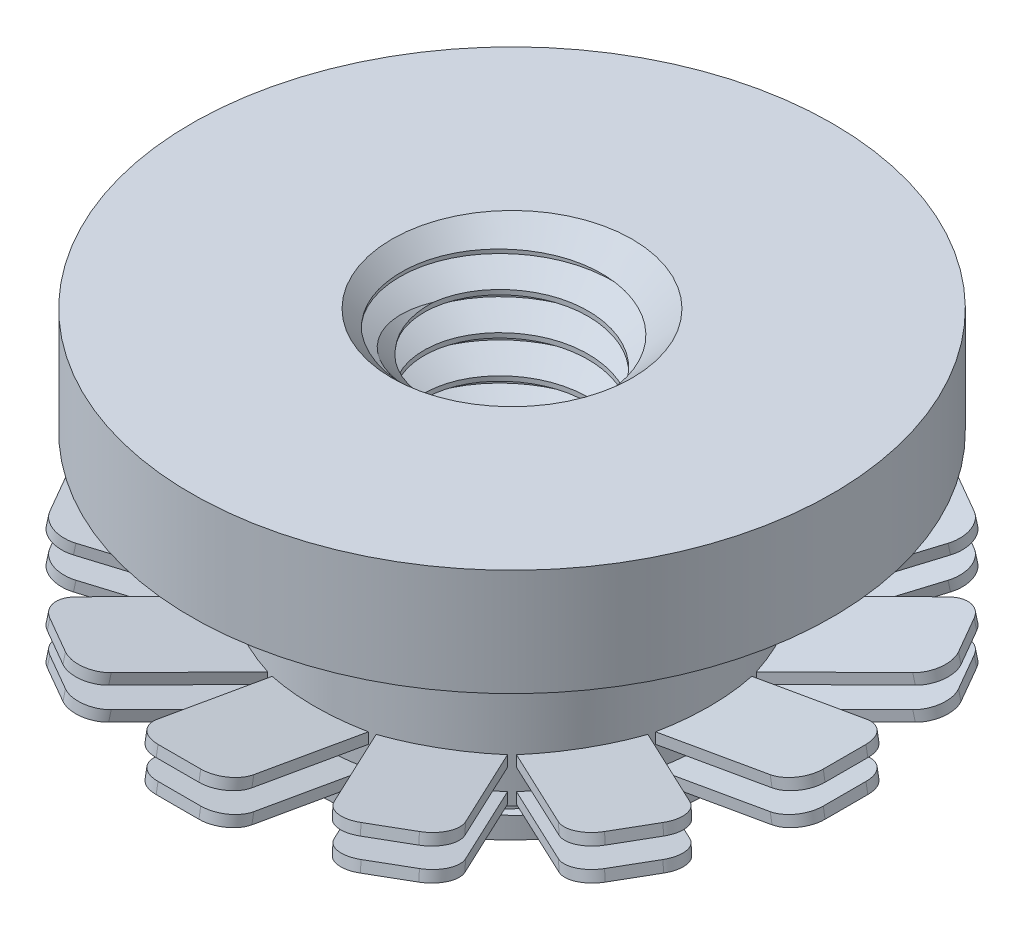
from build123d import *

# Parameters (mm, degrees)
CROWN_TOOTH_DEPTH            = 0.9
CROWN_TOOTH_DEPTH_BACK       = 0.9
FILLET1_R                    = 0.5
TOOTH_PATTERN_COUNT          = 12
LPATTERN3_COUNT              = 2
LPATTERN3_PITCH              = 0.6
SWEEP1_PITCH                 = 0.7
SKETCH10_R                   = 2.25
CUT_EXTRUDE1_OTHER_WAY_DEPTH = 11.695219757
CUT_EXTRUDE1_OTHER_WAY_TAPER = -45


with BuildPart() as part:
    # Sketch2 → Body (revolve)
    with BuildSketch(Plane.XY, mode=Mode.PRIVATE) as body_sk:
        Polygon((-2, 6), (-6, 6), (-6, 4), (-5.2, 4), (-5.2, 3.5), (-3.7, 3.5), (-3.7, 0.55), (-3.55, 0.55), (-3.55, 0.4), (-3.7, 0.4), (-3.7, 0), (-2, 0), align=None)
    revolve(body_sk.sketch.rotate(Axis((0, 0, 0), (0, 1, 0)), 270), axis=Axis((0, 0, 0), (0, 1, 0)))

    # Sweep1: the profile of Sketch9 profile screwed along a right-hand helix of 7.857143 turns, 6 arcs to a turn; built about Z, then put on its axis
    sweep1_z = Axis((0, 0, 0), (0, 0, 1))
    sweep1_corners = [(2.0003, 0, -0.612673205), (2.0003, 0, 0.000173205), (1.545336663, 0, -0.2625), (1.545336663, 0, -0.35)]
    with BuildLine(mode=Mode.PRIVATE) as sweep1_profile:
        Line(sweep1_corners[0], sweep1_corners[1])
        Line(sweep1_corners[1], sweep1_corners[2])
        Line(sweep1_corners[2], sweep1_corners[3])
        Line(sweep1_corners[3], sweep1_corners[0])
    sweep1_cap = Face(sweep1_profile.wire())
    sweep1_turn_angles = [0, 30, 60, 90, 120, 150, 180, 210, 240, 270, 300, 330, 360]
    sweep1_turn_weights = [1, 0.8660254037844387, 1, 0.8660254037844387, 1, 0.8660254037844387, 1, 0.8660254037844387, 1, 0.8660254037844387, 1, 0.8660254037844387, 1]
    sweep1_turn_rails = [Edge.make_bspline([Vector(p[0], p[1], 0).rotate(sweep1_z, sweep1_turn_angles[k]) / sweep1_turn_weights[k] + Vector(0, 0, p[2] + SWEEP1_PITCH * sweep1_turn_angles[k] / 360) for k in range(13)], [0, 0, 0, 1, 1, 2, 2, 3, 3, 4, 4, 5, 5, 6, 6, 6], 2, sweep1_turn_weights) for p in sweep1_corners]
    sweep1_turn_sides = [Face.make_surface_from_curves(sweep1_turn_rails[p[0]], sweep1_turn_rails[p[1]]) for p in [(0, 1), (1, 2), (2, 3), (3, 0)]]
    sweep1_last_angles = [2520, 2550, 2580, 2610, 2640, 2670, 2700, 2730, 2760, 2790, 2820, 2824.285714286, 2828.571428571]
    sweep1_last_weights = [1, 0.8660254037844387, 1, 0.8660254037844387, 1, 0.8660254037844387, 1, 0.8660254037844387, 1, 0.8660254037844387, 1, 0.9972037971811696, 1]
    sweep1_last_rails = [Edge.make_bspline([Vector(p[0], p[1], 0).rotate(sweep1_z, sweep1_last_angles[k]) / sweep1_last_weights[k] + Vector(0, 0, p[2] + SWEEP1_PITCH * sweep1_last_angles[k] / 360) for k in range(13)], [0, 0, 0, 1, 1, 2, 2, 3, 3, 4, 4, 5, 5, 6, 6, 6], 2, sweep1_last_weights) for p in sweep1_corners]
    sweep1_last_sides = [Face.make_surface_from_curves(sweep1_last_rails[p[0]], sweep1_last_rails[p[1]]) for p in [(0, 1), (1, 2), (2, 3), (3, 0)]]
    sweep1 = Plane(origin=(0, 6, 0), x_dir=(1, 0, 0), z_dir=(0, -1, 0)) * Solid(Shell([*[p.moved(Location((0, 0, SWEEP1_PITCH * i))) for i in range(7) for p in sweep1_turn_sides], *sweep1_last_sides, sweep1_cap, sweep1_cap.rotate(sweep1_z, 2828.571428571).moved(Location((0, 0, SWEEP1_PITCH * 2828.571428571 / 360)))]))
    add(sweep1)

    # Cut-Extrude1 cone 1 section (through the dimple's axis) → Cut-Extrude1 (revolve, cut)
    with BuildSketch(Plane(origin=(0, 6, 0), x_dir=(0, 0, 1), z_dir=(1, 0, 0))):
        Polygon((0, 0), (2.25, 0), (0, 2.25), align=None)
    revolve(axis=Axis((0, 6, 0), (0, -1, 0)), mode=Mode.SUBTRACT)

    # Sketch10 → Cut-Extrude1 other way (cut)
    with BuildSketch(Plane(origin=(0, 6, 0), x_dir=(1, 0, 0), z_dir=(0, 1, 0))):
        Circle(SKETCH10_R)
    extrude(amount=CUT_EXTRUDE1_OTHER_WAY_DEPTH, taper=CUT_EXTRUDE1_OTHER_WAY_TAPER, mode=Mode.SUBTRACT)


with BuildPart() as body_2:
    # Sketch5 → crown Tooth (new, two sides: drawn at the far end of the back side and taken through both)
    with BuildSketch(Plane.XY.offset(-CROWN_TOOTH_DEPTH_BACK)):
        Polygon((-6.260500158, 1.051485262), (-6.225770522, 1.248446813), (-3.465270364, 0.761696154), (-3.5, 0.564734604), align=None)
    extrude(amount=CROWN_TOOTH_DEPTH + CROWN_TOOTH_DEPTH_BACK)

    # Fillet1
    fillet1_edges = [body_2.edges().sort_by_distance(p)[0] for p in [
        (-6.24313534, 1.149966037, -0.9),
        (-6.24313534, 1.149966037, 0.9),
    ]]
    fillet(fillet1_edges, radius=FILLET1_R)


with BuildPart() as tooth_pattern_1:
    # Tooth Pattern: pattern copy
    add(body_2.part.rotate(Axis((0, 0, 0), (0, 1, 0)), 1 * 360 / TOOTH_PATTERN_COUNT))


with BuildPart() as tooth_pattern_2:
    # Tooth Pattern: pattern copy
    add(body_2.part.rotate(Axis((0, 0, 0), (0, 1, 0)), 2 * 360 / TOOTH_PATTERN_COUNT))


with BuildPart() as tooth_pattern_3:
    # Tooth Pattern: pattern copy
    add(body_2.part.rotate(Axis((0, 0, 0), (0, 1, 0)), 3 * 360 / TOOTH_PATTERN_COUNT))


with BuildPart() as tooth_pattern_4:
    # Tooth Pattern: pattern copy
    add(body_2.part.rotate(Axis((0, 0, 0), (0, 1, 0)), 4 * 360 / TOOTH_PATTERN_COUNT))


with BuildPart() as tooth_pattern_5:
    # Tooth Pattern: pattern copy
    add(body_2.part.rotate(Axis((0, 0, 0), (0, 1, 0)), 5 * 360 / TOOTH_PATTERN_COUNT))


with BuildPart() as tooth_pattern_6:
    # Tooth Pattern: pattern copy
    add(body_2.part.rotate(Axis((0, 0, 0), (0, 1, 0)), 6 * 360 / TOOTH_PATTERN_COUNT))


with BuildPart() as tooth_pattern_7:
    # Tooth Pattern: pattern copy
    add(body_2.part.rotate(Axis((0, 0, 0), (0, 1, 0)), 7 * 360 / TOOTH_PATTERN_COUNT))


with BuildPart() as tooth_pattern_8:
    # Tooth Pattern: pattern copy
    add(body_2.part.rotate(Axis((0, 0, 0), (0, 1, 0)), 8 * 360 / TOOTH_PATTERN_COUNT))


with BuildPart() as tooth_pattern_9:
    # Tooth Pattern: pattern copy
    add(body_2.part.rotate(Axis((0, 0, 0), (0, 1, 0)), 9 * 360 / TOOTH_PATTERN_COUNT))


with BuildPart() as tooth_pattern_10:
    # Tooth Pattern: pattern copy
    add(body_2.part.rotate(Axis((0, 0, 0), (0, 1, 0)), 10 * 360 / TOOTH_PATTERN_COUNT))


with BuildPart() as tooth_pattern_11:
    # Tooth Pattern: pattern copy
    add(body_2.part.rotate(Axis((0, 0, 0), (0, 1, 0)), 11 * 360 / TOOTH_PATTERN_COUNT))


with BuildPart() as lpattern3_1:
    # LPattern3: pattern copy
    add(tooth_pattern_1.part.moved(Location(Vector(0, 1, 0) * (1 * LPATTERN3_PITCH))))


with BuildPart() as lpattern3_2:
    # LPattern3: pattern copy
    add(body_2.part.moved(Location(Vector(0, 1, 0) * (1 * LPATTERN3_PITCH))))


with BuildPart() as lpattern3_3:
    # LPattern3: pattern copy
    add(tooth_pattern_3.part.moved(Location(Vector(0, 1, 0) * (1 * LPATTERN3_PITCH))))


with BuildPart() as lpattern3_4:
    # LPattern3: pattern copy
    add(tooth_pattern_2.part.moved(Location(Vector(0, 1, 0) * (1 * LPATTERN3_PITCH))))


with BuildPart() as lpattern3_5:
    # LPattern3: pattern copy
    add(tooth_pattern_11.part.moved(Location(Vector(0, 1, 0) * (1 * LPATTERN3_PITCH))))


with BuildPart() as lpattern3_6:
    # LPattern3: pattern copy
    add(tooth_pattern_10.part.moved(Location(Vector(0, 1, 0) * (1 * LPATTERN3_PITCH))))


with BuildPart() as lpattern3_7:
    # LPattern3: pattern copy
    add(tooth_pattern_9.part.moved(Location(Vector(0, 1, 0) * (1 * LPATTERN3_PITCH))))


with BuildPart() as lpattern3_8:
    # LPattern3: pattern copy
    add(tooth_pattern_8.part.moved(Location(Vector(0, 1, 0) * (1 * LPATTERN3_PITCH))))


with BuildPart() as lpattern3_9:
    # LPattern3: pattern copy
    add(tooth_pattern_7.part.moved(Location(Vector(0, 1, 0) * (1 * LPATTERN3_PITCH))))


with BuildPart() as lpattern3_10:
    # LPattern3: pattern copy
    add(tooth_pattern_6.part.moved(Location(Vector(0, 1, 0) * (1 * LPATTERN3_PITCH))))


with BuildPart() as lpattern3_11:
    # LPattern3: pattern copy
    add(tooth_pattern_5.part.moved(Location(Vector(0, 1, 0) * (1 * LPATTERN3_PITCH))))


with BuildPart() as lpattern3_12:
    # LPattern3: pattern copy
    add(tooth_pattern_4.part.moved(Location(Vector(0, 1, 0) * (1 * LPATTERN3_PITCH))))


with BuildPart() as tooth_pattern_9_1:
    add(tooth_pattern_9.part)

    # Combine1: union Tooth Pattern_10, Tooth Pattern_11, body 2, Tooth Pattern_1, Tooth Pattern_2, Tooth Pattern_3, part, Tooth Pattern_4, Tooth Pattern_5, Tooth Pattern_6, Tooth Pattern_7, Tooth Pattern_8, LPattern3_5, LPattern3_6, LPattern3_7, LPattern3_2, LPattern3_1, LPattern3_4, LPattern3_3, LPattern3_12, LPattern3_11, LPattern3_10, LPattern3_9, LPattern3_8
    add(tooth_pattern_10.part)
    add(tooth_pattern_11.part)
    add(body_2.part)
    add(tooth_pattern_1.part)
    add(tooth_pattern_2.part)
    add(tooth_pattern_3.part)
    add(part.part)
    add(tooth_pattern_4.part)
    add(tooth_pattern_5.part)
    add(tooth_pattern_6.part)
    add(tooth_pattern_7.part)
    add(tooth_pattern_8.part)
    add(lpattern3_5.part)
    add(lpattern3_6.part)
    add(lpattern3_7.part)
    add(lpattern3_2.part)
    add(lpattern3_1.part)
    add(lpattern3_4.part)
    add(lpattern3_3.part)
    add(lpattern3_12.part)
    add(lpattern3_11.part)
    add(lpattern3_10.part)
    add(lpattern3_9.part)
    add(lpattern3_8.part)


solid = tooth_pattern_9_1.part
